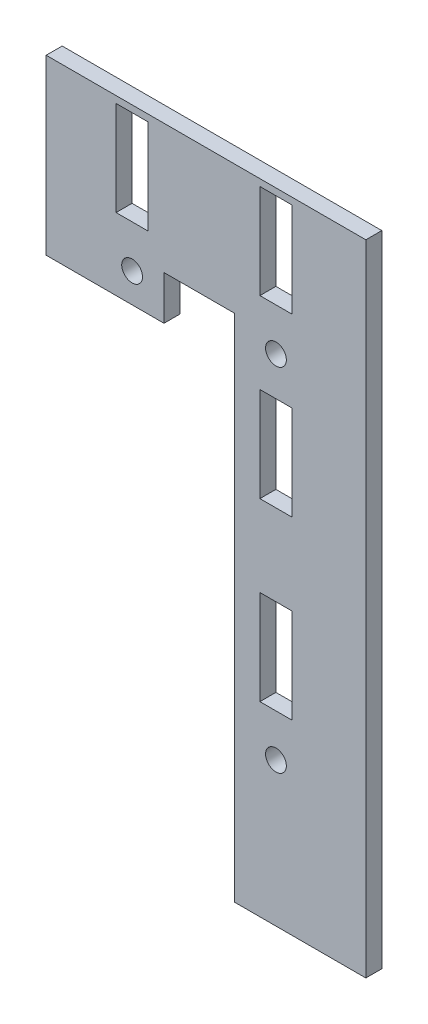
from build123d import *

# Parameters (mm, degrees)
SKETCH1_W           = 101.6
SKETCH1_H           = 50.8
BOSS_EXTRUDE1_DEPTH = 2.54
SKETCH2_R           = 1.651
CUT_EXTRUDE1_DEPTH  = 57.852894385
SKETCH3_W           = 5.1
SKETCH3_H           = 15.02
CUT_EXTRUDE4_DEPTH  = 57.852894385
CUT_EXTRUDE5_DEPTH  = 57.852894385


with BuildPart() as part:
    # Sketch1 → Boss-Extrude1 (new body)
    with BuildSketch(Plane(origin=(0, 0, 0), x_dir=(0, 1, 0), z_dir=(0, 0, 1))):
        Rectangle(SKETCH1_W, SKETCH1_H)
    extrude(amount=BOSS_EXTRUDE1_DEPTH)

    # Sketch2 → Cut-Extrude1 (cut, through all)
    with BuildSketch(Plane.XY.offset(2.54)):
        with Locations((11.115903034, 27.94)):
            Circle(SKETCH2_R)
        with Locations((11.115903034, -27.94)):
            Circle(SKETCH2_R)
        with Locations((-11.744096966, 27.94)):
            Circle(SKETCH2_R)
    extrude(amount=-CUT_EXTRUDE1_DEPTH, mode=Mode.SUBTRACT)

    # Sketch3 → Cut-Extrude4 (cut, through all)
    with BuildSketch(Plane.XY.offset(2.54)):
        with Locations((11.115903034, -13.67)):
            Rectangle(SKETCH3_W, SKETCH3_H)
        with Locations((11.115903034, 14.27)):
            Rectangle(SKETCH3_W, SKETCH3_H)
        with Locations((11.115903034, 42.21)):
            Rectangle(SKETCH3_W, SKETCH3_H)
        with Locations((-11.744096966, 42.21)):
            Rectangle(SKETCH3_W, SKETCH3_H)
    extrude(amount=-CUT_EXTRUDE4_DEPTH, mode=Mode.SUBTRACT)

    # Sketch5 → Cut-Extrude5 (cut, through all)
    with BuildSketch(Plane.XY.offset(2.54)):
        Polygon((4.501903034, -50.8), (4.501903034, 30.255), (-6.674096966, 30.255), (-6.674096966, 23.27), (-25.4, 23.27), (-25.4, -50.8), align=None)
    extrude(amount=-CUT_EXTRUDE5_DEPTH, mode=Mode.SUBTRACT)


solid = part.part
